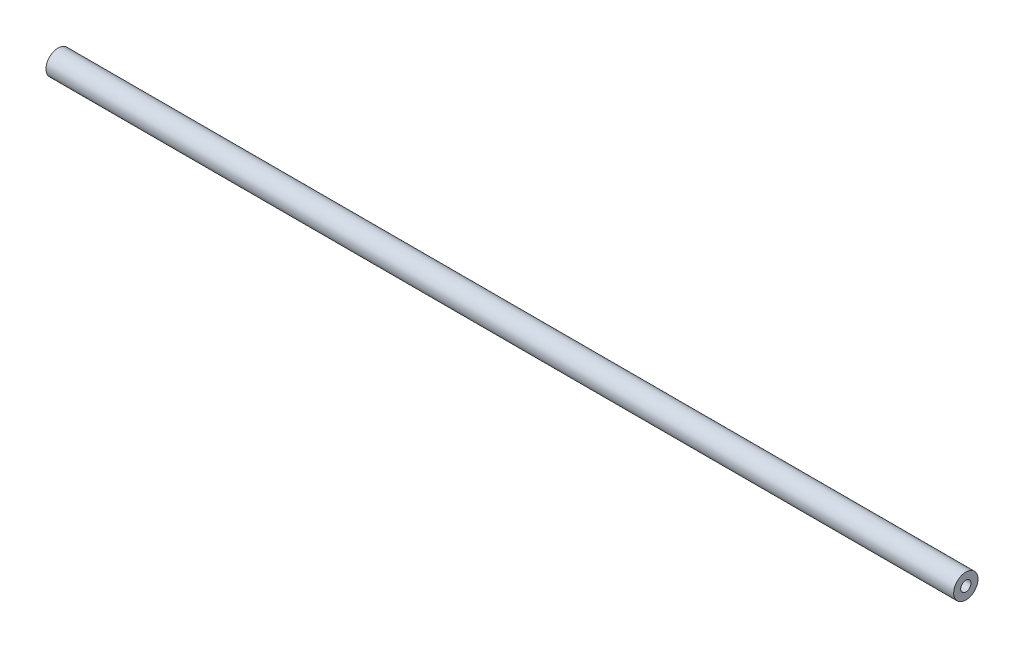
from build123d import *

# Parameters (mm, degrees)
SKETCH1_R                            = 4.7625
BOSS_EXTRUDE1_DEPTH                  = 177.8
F_10_32_TAPPED_HOLE1_D               = 4.0386
F_10_32_TAPPED_HOLE1_DEPTH           = 12.02944
F_10_32_TAPPED_HOLE1_TIP             = 1.213317848
F_10_32_TAPPED_HOLE1_ON_FACE_2_D     = 4.0386
F_10_32_TAPPED_HOLE1_ON_FACE_2_DEPTH = 12.02944
F_10_32_TAPPED_HOLE1_ON_FACE_2_TIP   = 1.213317848


with BuildPart() as part:
    # Sketch1 → Boss-Extrude1 (new, symmetric)
    with BuildSketch(Plane(origin=(0, 0, 0), x_dir=(0, 0, -1), z_dir=(1, 0, 0))):
        Circle(SKETCH1_R)
    extrude(amount=BOSS_EXTRUDE1_DEPTH, both=True)

    # #10-32 Tapped Hole1
    with Locations(Plane(origin=(177.8, 0, 0), x_dir=(0, 0, 1), z_dir=(1, 0, 0))):
        with Locations((0, 0)):
            Hole(F_10_32_TAPPED_HOLE1_D / 2, depth=F_10_32_TAPPED_HOLE1_DEPTH)
            with Locations((0, 0, -(F_10_32_TAPPED_HOLE1_DEPTH + F_10_32_TAPPED_HOLE1_TIP / 2))):  # 118° drill point
                Cone(0, F_10_32_TAPPED_HOLE1_D / 2, F_10_32_TAPPED_HOLE1_TIP, mode=Mode.SUBTRACT)

    # #10-32 Tapped Hole1 on face 2
    with Locations(Plane(origin=(-177.8, 0, 0), x_dir=(0, 0, -1), z_dir=(-1, 0, 0))):
        with Locations((0, 0)):
            Hole(F_10_32_TAPPED_HOLE1_ON_FACE_2_D / 2, depth=F_10_32_TAPPED_HOLE1_ON_FACE_2_DEPTH)
            with Locations((0, 0, -(F_10_32_TAPPED_HOLE1_ON_FACE_2_DEPTH + F_10_32_TAPPED_HOLE1_ON_FACE_2_TIP / 2))):  # 118° drill point
                Cone(0, F_10_32_TAPPED_HOLE1_ON_FACE_2_D / 2, F_10_32_TAPPED_HOLE1_ON_FACE_2_TIP, mode=Mode.SUBTRACT)


solid = part.part
